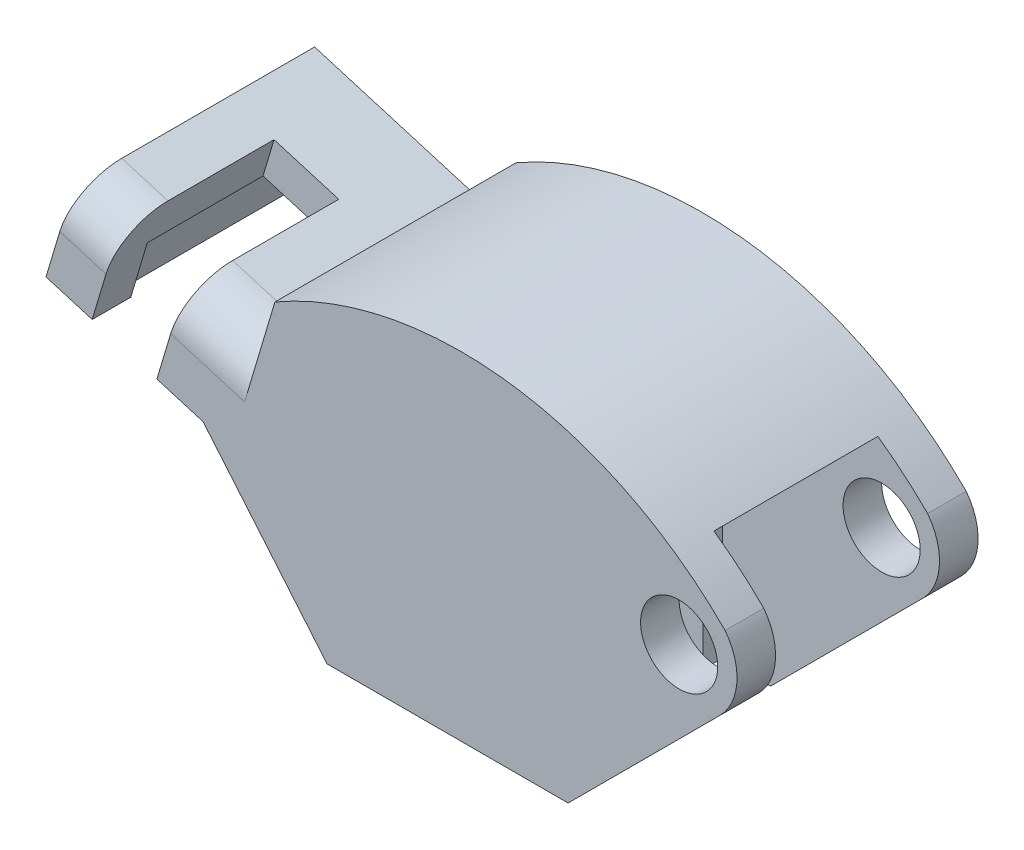
from build123d import *

# Parameters (mm, degrees)
SKETCH2_R                = 4
BOSS_EXTRUDE1_DEPTH      = 25
SHELL1_START             = 4
SHELL1_DEPTH             = 17
SKETCH4_W                = 10
SKETCH4_H                = 16
CUT_EXTRUDE1_DEPTH       = 2
SKETCH5_W                = 10
SKETCH5_H                = 16
CUT_EXTRUDE2_DEPTH       = 2
BOSS_EXTRUDE2_REACH      = 60.764
BOSS_EXTRUDE2_END_RADIUS = 34.587437562
SKETCH12_W               = 3
SKETCH12_H               = 2
CUT_EXTRUDE3_DEPTH       = 16
FILLET1_R                = 5
SKETCH14_R               = 8
CUT_EXTRUDE4_DEPTH       = 17


# Read off the part's stored shape, not the designer's step: Shell1
with BuildPart() as part:
    # Sketch2 → Boss-Extrude1 (new body)
    with BuildSketch(Plane.XY):
        with BuildLine():
            ThreePointArc((-16.302119642, 29.796788513), (8.090433332, 34.669313021), (30.38825142, 23.64454798))
            ThreePointArc((30.38825142, 23.64454798), (31.608808708, 19.602540573), (29.864628369, 15.757359313))
            Line((29.864628369, 15.757359313), (14.107269056, 0))
            Line((14.107269056, 0), (-10.892730944, 0))
            Line((-10.892730944, 0), (-23.748483138, 15.320888862))
            Line((-23.748483138, 15.320888862), (-40.039838772, 20.178020896))
            Line((-40.039838772, 20.178020896), (-37.182702282, 29.761171269))
            Line((-37.182702282, 29.761171269), (-18.016401536, 24.046898289))
            Line((-18.016401536, 24.046898289), (-16.302119642, 29.796788513))
        make_face()
        with Locations((25.621987682, 20)):
            Circle(SKETCH2_R, mode=Mode.SUBTRACT)
    extrude(amount=BOSS_EXTRUDE1_DEPTH)

    # Shell1 outline → Shell1 (cut)
    with BuildSketch(Plane.XY.offset(SHELL1_START)):
        with BuildLine():
            ThreePointArc((20.592180868, 26.221016269), (3.939176513, 30.988554812), (-12.936984293, 27.083791792))
            Line((-12.936984293, 27.083791792), (-15.325995982, 19.070783543))
            Line((-15.325995982, 19.070783543), (-34.492296729, 24.785056524))
            Line((-34.492296729, 24.785056524), (-36.206578623, 19.0351663))
            Line((-36.206578623, 19.0351663), (-23.748483138, 15.320888862))
            Line((-23.748483138, 15.320888862), (-10.892730944, 0))
            Line((-10.892730944, 0), (14.107269056, 0))
            Line((14.107269056, 0), (26.122970982, 12.015701926))
            ThreePointArc((26.122970982, 12.015701926), (18.16710341, 17.097466537), (20.592180868, 26.221016269))
        make_face()
    extrude(amount=SHELL1_DEPTH, mode=Mode.SUBTRACT)

    # Sketch4 → Cut-Extrude1 (cut)
    with BuildSketch(Plane.XY.offset(4)):
        with Locations((1.107269056, 8)):
            Rectangle(SKETCH4_W, SKETCH4_H)
    extrude(amount=-CUT_EXTRUDE1_DEPTH, mode=Mode.SUBTRACT)

    # Sketch5 → Cut-Extrude2 (cut)
    with BuildSketch(Plane(origin=(0, 0, 21), x_dir=(-1, 0, 0), z_dir=(0, 0, -1))):
        with Locations((-1.107269056, 8)):
            Rectangle(SKETCH5_W, SKETCH5_H)
    extrude(amount=-CUT_EXTRUDE2_DEPTH, mode=Mode.SUBTRACT)

    # Boss-Extrude2: up to this cylinder (the profile starts inside it)
    boss_extrude2_end = Plane(origin=(3.049463937, -3.587437562, 12.5), z_dir=(0, 0, -1)) * Cylinder(BOSS_EXTRUDE2_END_RADIUS, 206.702875123, mode=Mode.PRIVATE)
    # Sketch12 → Boss-Extrude2 (add, up to the surface)
    with BuildSketch(Plane.XZ, mode=Mode.PRIVATE) as boss_extrude2_sk1:
        with Locations((-5.392730944, 20)):
            Rectangle(SKETCH12_W, SKETCH12_H)
    boss_extrude2_tool1 = extrude(boss_extrude2_sk1.sketch, amount=-BOSS_EXTRUDE2_REACH, mode=Mode.PRIVATE) & boss_extrude2_end
    add(boss_extrude2_tool1.solids().sort_by_distance((-5.392731, 0, 20))[0])
    # Sketch12 → Boss-Extrude2 (add, up to the surface)
    with BuildSketch(Plane.XZ, mode=Mode.PRIVATE) as boss_extrude2_sk2:
        with Locations((7.607269056, 20)):
            Rectangle(SKETCH12_W, SKETCH12_H)
    boss_extrude2_tool2 = extrude(boss_extrude2_sk2.sketch, amount=-BOSS_EXTRUDE2_REACH, mode=Mode.PRIVATE) & boss_extrude2_end
    add(boss_extrude2_tool2.solids().sort_by_distance((7.607269, 0, 20))[0])
    # Sketch12 → Boss-Extrude2 (add, up to the surface)
    with BuildSketch(Plane.XZ, mode=Mode.PRIVATE) as boss_extrude2_sk3:
        with Locations((-5.392730944, 5)):
            Rectangle(SKETCH12_W, SKETCH12_H)
    boss_extrude2_tool3 = extrude(boss_extrude2_sk3.sketch, amount=-BOSS_EXTRUDE2_REACH, mode=Mode.PRIVATE) & boss_extrude2_end
    add(boss_extrude2_tool3.solids().sort_by_distance((-5.392731, 0, 5))[0])
    # Sketch12 → Boss-Extrude2 (add, up to the surface)
    with BuildSketch(Plane.XZ, mode=Mode.PRIVATE) as boss_extrude2_sk4:
        with Locations((7.607269056, 5)):
            Rectangle(SKETCH12_W, SKETCH12_H)
    boss_extrude2_tool4 = extrude(boss_extrude2_sk4.sketch, amount=-BOSS_EXTRUDE2_REACH, mode=Mode.PRIVATE) & boss_extrude2_end
    add(boss_extrude2_tool4.solids().sort_by_distance((7.607269, 0, 5))[0])

    # Sketch13 → Cut-Extrude3 (cut)
    with BuildSketch(Plane.XY.offset(25)):
        Polygon((-32.391127096, 28.332603024), (-35.248263586, 18.749452651), (-28.540058324, 16.749457107), (-25.682921834, 26.332607481), align=None)
    extrude(amount=-CUT_EXTRUDE3_DEPTH, mode=Mode.SUBTRACT)

    # Fillet1
    fillet1_edges = [part.edges().sort_by_distance(p)[0] for p in [
        (-34.786914689, 29.046887146, 25),
        (-21.849661685, 25.189752885, 25),
    ]]
    fillet(fillet1_edges, radius=FILLET1_R)

    # Sketch14 → Cut-Extrude4 (cut)
    with BuildSketch(Plane.XY.offset(4)):
        with Locations((25.621987682, 20)):
            Circle(SKETCH14_R)
    extrude(amount=CUT_EXTRUDE4_DEPTH, mode=Mode.SUBTRACT)


solid = part.part
